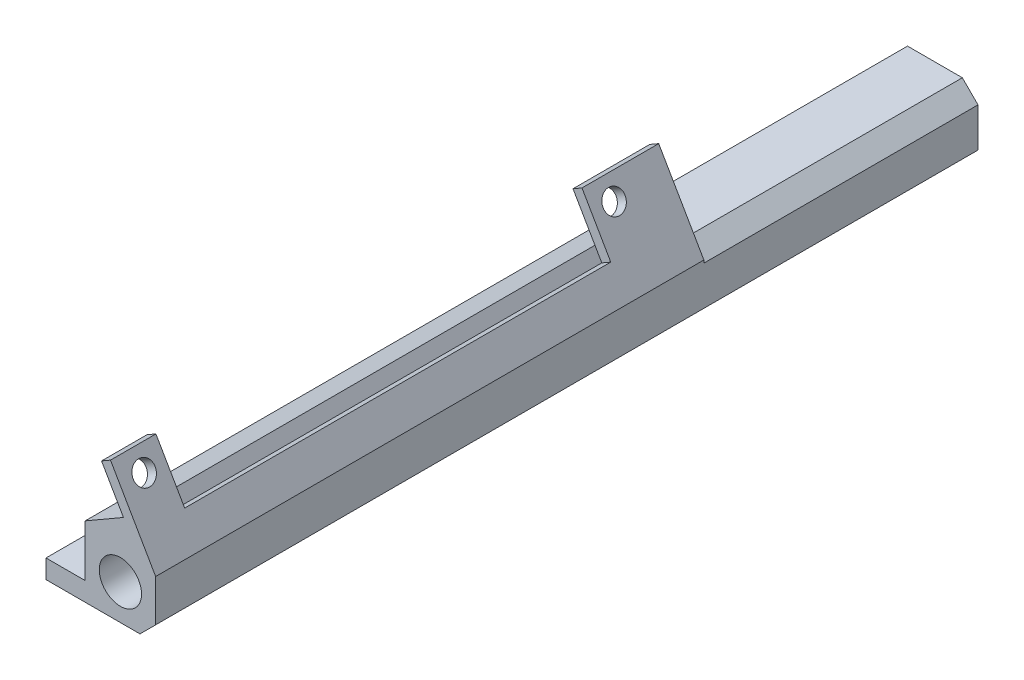
from build123d import *

# Parameters (mm, degrees)
SKETCH1_W           = 77.47
SKETCH1_H           = 133.35
BOSS_EXTRUDE1_DEPTH = 11.43
SKETCH2_R           = 3.429
CUT_EXTRUDE1_DEPTH  = 155.643035084
CUT_EXTRUDE2_DEPTH  = 155.643035084
SKETCH4_W           = 54.61
SKETCH4_H           = 6.35
CUT_EXTRUDE3_DEPTH  = 155.643035084
CHAMFER1_SIZE       = 2.54
SKETCH5_W           = 66.04
SKETCH5_H           = 50.8
CUT_EXTRUDE4_DEPTH  = 155.643035084
SKETCH6_W           = 53.34
SKETCH6_H           = 82.55
CUT_EXTRUDE5_DEPTH  = 155.643035084
SKETCH7_R           = 1.778
HOLE_CUTS_1_DEPTH   = 155.350723678
BOSS_EXTRUDE2_DEPTH = 88.9
CUT_EXTRUDE7_REACH  = 157.718
SKETCH9_W           = 6.35
SKETCH9_H           = 5.08
CUT_EXTRUDE8_REACH  = 157.718
SKETCH10_W          = 6.35
SKETCH10_H          = 1.27
HOLE_CUTS_2_REACH   = 140.879
SKETCH11_R          = 1.778
SKETCH12_W          = 88.9
SKETCH12_H          = 11.176
CUT_EXTRUDE10_DEPTH = 1.27
CUT_EXTRUDE15_DEPTH = 156.631628444
SKETCH14_W          = 6.35
SKETCH14_H          = 82.55
CUT_EXTRUDE12_DEPTH = 0.762
SKETCH15_W          = 1.676805635
SKETCH15_H          = 88.9
BOSS_EXTRUDE3_DEPTH = 1.27
CUT_EXTRUDE13_REACH = 140.894
SKETCH16_W          = 69.088
SKETCH16_H          = 9.3345
CUT_EXTRUDE14_REACH = 156.786
SKETCH17_W          = 1.27
SKETCH17_H          = 88.9


with BuildPart() as part:
    # Sketch1 → Boss-Extrude1 (new body)
    with BuildSketch(Plane(origin=(0, 0, 0), x_dir=(1, 0, 0), z_dir=(0, 1, 0))):
        with Locations((38.735, 66.675)):
            Rectangle(SKETCH1_W, SKETCH1_H)
    extrude(amount=BOSS_EXTRUDE1_DEPTH)

    # Sketch2 → Cut-Extrude1 (cut, through all)
    with BuildSketch(Plane.XY):
        with Locations((5.715, 5.715)):
            Circle(SKETCH2_R)
        with Locations((71.755, 5.715)):
            Circle(SKETCH2_R)
    extrude(amount=-CUT_EXTRUDE1_DEPTH, mode=Mode.SUBTRACT)

    # Sketch3 → Cut-Extrude2 (cut, through all)
    with BuildSketch(Plane(origin=(0, 11.43, 0), x_dir=(1, 0, 0), z_dir=(0, 1, 0))):
        with BuildLine():
            Line((11.43, 133.35), (11.43, 95.25))
            ThreePointArc((11.43, 95.25), (15.149743879, 86.269743879), (24.13, 82.55))
            Line((24.13, 82.55), (53.34, 82.55))
            ThreePointArc((53.34, 82.55), (62.320256121, 86.269743879), (66.04, 95.25))
            Line((66.04, 95.25), (66.04, 133.35))
            Line((66.04, 133.35), (11.43, 133.35))
        make_face()
    extrude(amount=-CUT_EXTRUDE2_DEPTH, mode=Mode.SUBTRACT)

    # Sketch4 → Cut-Extrude3 (cut, through all)
    with BuildSketch(Plane(origin=(0, 0, -133.35), x_dir=(-1, 0, 0), z_dir=(0, 0, -1))):
        with Locations((-38.735, 8.255)):
            Rectangle(SKETCH4_W, SKETCH4_H)
    extrude(amount=-CUT_EXTRUDE3_DEPTH, mode=Mode.SUBTRACT)

    # Chamfer1
    chamfer1_edges = [part.edges().sort_by_distance(p)[0] for p in [
        (0, 0, -66.675),
        (0, 11.43, -66.675),
        (77.47, 0, -66.675),
        (77.47, 11.43, -66.675),
    ]]
    chamfer(chamfer1_edges, length=CHAMFER1_SIZE)

    # Sketch5 → Cut-Extrude4 (cut, through all)
    with BuildSketch(Plane(origin=(0, 11.43, 0), x_dir=(1, 0, 0), z_dir=(0, 1, 0))):
        with Locations((33.02, 107.95)):
            Rectangle(SKETCH5_W, SKETCH5_H)
    extrude(amount=-CUT_EXTRUDE4_DEPTH, mode=Mode.SUBTRACT)

    # Sketch6 → Cut-Extrude5 (cut, through all)
    with BuildSketch(Plane(origin=(0, 11.43, 0), x_dir=(1, 0, 0), z_dir=(0, 1, 0))):
        with Locations((26.67, 41.275)):
            Rectangle(SKETCH6_W, SKETCH6_H)
    extrude(amount=-CUT_EXTRUDE5_DEPTH, mode=Mode.SUBTRACT)

    # Sketch7 → Hole Cuts 1 (cut, through all)
    with BuildSketch(Plane(origin=(0, 5.08, 0), x_dir=(1, 0, 0), z_dir=(0, 1, 0))):
        with Locations((62.23, 74.93)):
            Circle(SKETCH7_R)
        with Locations((62.23, 13.97)):
            Circle(SKETCH7_R)
    extrude(amount=-HOLE_CUTS_1_DEPTH, mode=Mode.SUBTRACT)

    # Sketch8 → Boss-Extrude2 (add)
    with BuildSketch(Plane.XY):
        Polygon((77.47, 11.869940905), (77.47, 8.89), (74.93, 11.43), (66.04, 11.43), (71.539261314, 14.605), (68.618261314, 19.664320409), (71.882, 21.548640818), align=None)
    extrude(amount=-BOSS_EXTRUDE2_DEPTH)

    # Sketch9 → Cut-Extrude7 (cut, up to next)
    with BuildSketch(Plane.XY, mode=Mode.PRIVATE) as cut_extrude7_sk1:
        with Locations((56.515, 2.54)):
            Rectangle(SKETCH9_W, SKETCH9_H)
    cut_extrude7_tool1 = extrude(cut_extrude7_sk1.sketch, amount=-CUT_EXTRUDE7_REACH, mode=Mode.PRIVATE) & part.part
    add(cut_extrude7_tool1.solids().sort_by_distance((56.515, 2.54, 0))[0], mode=Mode.SUBTRACT)

    # Sketch10 → Cut-Extrude8 (cut, up to next)
    with BuildSketch(Plane.XY, mode=Mode.PRIVATE) as cut_extrude8_sk1:
        with Locations((62.865, 4.445)):
            Rectangle(SKETCH10_W, SKETCH10_H)
    cut_extrude8_tool1 = extrude(cut_extrude8_sk1.sketch, amount=-CUT_EXTRUDE8_REACH, mode=Mode.PRIVATE) & part.part
    add(cut_extrude8_tool1.solids().sort_by_distance((62.865, 4.445, 0))[0], mode=Mode.SUBTRACT)

    # Sketch11 → Hole Cuts 2 (cut, up to next)
    with BuildSketch(Plane(origin=(59.978596497, 34.628658833, 0), x_dir=(0, 0, 1), z_dir=(-0.8660254037844403, -0.49999999999999745, 0)), mode=Mode.PRIVATE) as hole_cuts_2_sk1:
        with Locations((-3.81, -19.311329635)):
            Circle(SKETCH11_R)
    hole_cuts_2_tool1 = extrude(hole_cuts_2_sk1.sketch, amount=-HOLE_CUTS_2_REACH, mode=Mode.PRIVATE) & part.part
    # Sketch11 → Hole Cuts 2 (cut, up to next)
    with BuildSketch(Plane(origin=(59.978596497, 34.628658833, 0), x_dir=(0, 0, 1), z_dir=(-0.8660254037844403, -0.49999999999999745, 0)), mode=Mode.PRIVATE) as hole_cuts_2_sk2:
        with Locations((-80.01, -19.311329635)):
            Circle(SKETCH11_R)
    hole_cuts_2_tool2 = extrude(hole_cuts_2_sk2.sketch, amount=-HOLE_CUTS_2_REACH, mode=Mode.PRIVATE) & part.part
    add(hole_cuts_2_tool1.solids().sort_by_distance((69.634261, 17.904557, -3.81))[0], mode=Mode.SUBTRACT)
    add(hole_cuts_2_tool2.solids().sort_by_distance((69.634261, 17.904557, -80.01))[0], mode=Mode.SUBTRACT)

    # Sketch12 → Cut-Extrude10 (cut)
    with BuildSketch(Plane(origin=(63.242335183, 36.512979242, 0), x_dir=(0, 0, -1), z_dir=(0.8660254037844395, 0.49999999999999856, 0))):
        with Locations((44.45, -22.867329635)):
            Rectangle(SKETCH12_W, SKETCH12_H)
    extrude(amount=-CUT_EXTRUDE10_DEPTH, mode=Mode.SUBTRACT)

    # Sketch22 → Cut-Extrude15 (cut, through all)
    with BuildSketch(Plane.XY):
        Polygon((64.930582409, 17.535238), (69.32999146, 20.075238), (72.25099146, 15.015917591), (67.851582409, 12.475917591), align=None)
    extrude(amount=-CUT_EXTRUDE15_DEPTH, mode=Mode.SUBTRACT)

    # Sketch14 → Cut-Extrude12 (cut)
    with BuildSketch(Plane(origin=(0, 3.81, 0), x_dir=(1, 0, 0), z_dir=(0, 1, 0))):
        with Locations((62.865, 41.275)):
            Rectangle(SKETCH14_W, SKETCH14_H)
    extrude(amount=-CUT_EXTRUDE12_DEPTH, mode=Mode.SUBTRACT)

    # Sketch15 → Boss-Extrude3 (add)
    with BuildSketch(Plane(origin=(8.639664817, -14.964338424, 0), x_dir=(0.8660254037844382, 0.500000000000001, 0), z_dir=(-0.5000000000000009, 0.866025403784438, 0))):
        with Locations((70.917555667, 44.45)):
            Rectangle(SKETCH15_W, SKETCH15_H)
    extrude(amount=BOSS_EXTRUDE3_DEPTH)

    # Sketch16 → Cut-Extrude13 (cut, up to next)
    with BuildSketch(Plane(origin=(60.690326643, 35.039576424, 0), x_dir=(0, 0, 1), z_dir=(-0.866025403784438, -0.5000000000000012, 0)), mode=Mode.PRIVATE) as cut_extrude13_sk1:
        with Locations((-41.91, -20.676579635)):
            Rectangle(SKETCH16_W, SKETCH16_H)
    cut_extrude13_tool1 = extrude(cut_extrude13_sk1.sketch, amount=-CUT_EXTRUDE13_REACH, mode=Mode.PRIVATE) & part.part
    add(cut_extrude13_tool1.solids().sort_by_distance((71.028616, 17.133133, -41.91))[0], mode=Mode.SUBTRACT)

    # Sketch17 → Cut-Extrude14 (cut, up to next)
    with BuildSketch(Plane(origin=(14.227664817, -24.643038337, 0), x_dir=(0.8660254037844396, 0.4999999999999985, 0), z_dir=(-0.4999999999999985, 0.8660254037844396, 0)), mode=Mode.PRIVATE) as cut_extrude14_sk1:
        with Locations((72.390958484, 44.45)):
            Rectangle(SKETCH17_W, SKETCH17_H)
    cut_extrude14_tool1 = extrude(cut_extrude14_sk1.sketch, amount=-CUT_EXTRUDE14_REACH, mode=Mode.PRIVATE) & part.part
    add(cut_extrude14_tool1.solids().sort_by_distance((76.920074, 11.552441, -44.45))[0], mode=Mode.SUBTRACT)


solid = part.part
